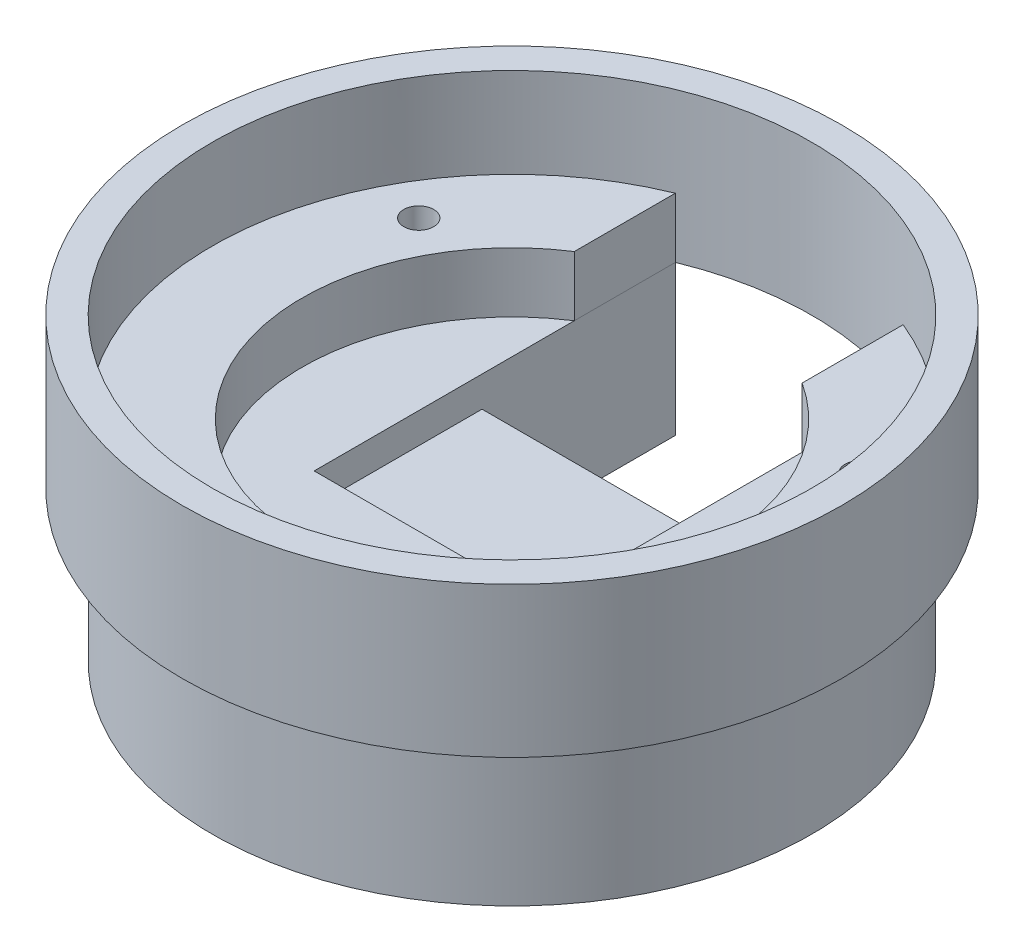
from build123d import *

# Parameters (mm, degrees)
SKETCH1_R                           = 27.5
SKETCH1_R_2                         = 25
BOSS_EXTRUDE1_DEPTH                 = 12.5
BOSS_EXTRUDE2_START                 = 12.5
SKETCH2_R                           = 25
BOSS_EXTRUDE2_DEPTH                 = 12.5
SKETCH3_R                           = 25
SKETCH3_R_2                         = 17.5
BOSS_EXTRUDE3_DEPTH                 = 5
SKETCH4_W                           = 19
SKETCH4_H                           = 14
CUT_EXTRUDE5_DEPTH                  = 2.54
CUT_EXTRUDE2_START                  = -12.5
CUT_EXTRUDE2_DEPTH                  = 12.5
CUT_EXTRUDE6_START                  = -5
CUT_EXTRUDE6_DEPTH                  = 5
TAP_START                           = -12.5
TAP_DRILL_FOR_M3X0_5_TAP1_OUTLINE_R = 1.25
TAP_DRILL_FOR_M3X0_5_TAP1_DEPTH     = 17.5


# Read off the part's stored shape, not the designer's step: Cut-Extrude2, Tap Drill for M3x0.5 Tap1
with BuildPart() as part:
    # Sketch1 → Boss-Extrude1 (new body)
    with BuildSketch(Plane(origin=(0, 0, 0), x_dir=(1, 0, 0), z_dir=(0, 1, 0))):
        with Locations(Location((0, 0, 0), (0, 0, 270))):
            Circle(SKETCH1_R)
        with Locations(Location((0, 0, 0), (0, 0, 270))):
            Circle(SKETCH1_R_2, mode=Mode.SUBTRACT)
    extrude(amount=BOSS_EXTRUDE1_DEPTH)

    # Sketch3 → Boss-Extrude3 (add)
    with BuildSketch(Plane(origin=(0, 0, 0), x_dir=(1, 0, 0), z_dir=(0, 1, 0))):
        with Locations(Location((0, 0, 0), (0, 0, 90))):
            Circle(SKETCH3_R)
        with Locations(Location((0, 0, 0), (0, 0, 270))):
            Circle(SKETCH3_R_2, mode=Mode.SUBTRACT)
    extrude(amount=BOSS_EXTRUDE3_DEPTH)

    # Sketch7 → Cut-Extrude6 (cut)
    with BuildSketch(Plane(origin=(0, 5, 0), x_dir=(1, 0, 0), z_dir=(0, 1, 0)).offset(CUT_EXTRUDE6_START)):
        with BuildLine():
            Line((9.5, 14.696938457), (9.5, 23.12466216))
            ThreePointArc((9.5, 23.12466216), (0, 25), (-9.5, 23.12466216))
            Line((-9.5, 23.12466216), (-9.5, 14.696938457))
            ThreePointArc((-9.5, 14.696938457), (0, 17.5), (9.5, 14.696938457))
        make_face()
    extrude(amount=CUT_EXTRUDE6_DEPTH, mode=Mode.SUBTRACT)


with BuildPart() as body_2:
    # Sketch2 → Boss-Extrude2 (new body)
    with BuildSketch(Plane.XZ.offset(BOSS_EXTRUDE2_START)):
        with Locations(Location((0, 0, 0), (0, 0, 270))):
            Circle(SKETCH2_R)
    extrude(amount=-BOSS_EXTRUDE2_DEPTH)

    # Sketch4 → Cut-Extrude5 (cut)
    with BuildSketch(Plane(origin=(0, 0, 0), x_dir=(1, 0, 0), z_dir=(0, 1, 0))):
        Rectangle(SKETCH4_W, SKETCH4_H)
    extrude(amount=-CUT_EXTRUDE5_DEPTH, mode=Mode.SUBTRACT)

    # Cut-Extrude2 outline → Cut-Extrude2 (cut)
    with BuildSketch(Plane(origin=(0, 0, 0), x_dir=(1, 0, 0), z_dir=(0, 1, 0)).offset(CUT_EXTRUDE2_START)):
        with BuildLine():
            ThreePointArc((9.5, 23.12466216), (0, 25), (-9.5, 23.12466216))
            Line((-9.5, 23.12466216), (-9.5, 7))
            Line((-9.5, 7), (9.5, 7))
            Line((9.5, 7), (9.5, 23.12466216))
        make_face()
    extrude(amount=CUT_EXTRUDE2_DEPTH, mode=Mode.SUBTRACT)


with BuildPart() as tap_drill_for_m3x0_5_tap1_tool:
    # Tap Drill for M3x0.5 Tap1 outline → Tap Drill for M3x0.5 Tap1 (new body)
    with BuildSketch(Plane(origin=(0, 0, 0), x_dir=(1, 0, 0), z_dir=(0, 1, 0)).offset(TAP_START)):
        with Locations((-18.40303983, 10.625)):
            Circle(TAP_DRILL_FOR_M3X0_5_TAP1_OUTLINE_R)
        with Locations((0, -21.25)):
            Circle(TAP_DRILL_FOR_M3X0_5_TAP1_OUTLINE_R)
        with Locations((18.40303983, 10.625)):
            Circle(TAP_DRILL_FOR_M3X0_5_TAP1_OUTLINE_R)
    extrude(amount=TAP_DRILL_FOR_M3X0_5_TAP1_DEPTH)


with BuildPart() as part_1:
    add(part.part)

    # Tap Drill for M3x0.5 Tap1: cut by tap_drill_for_m3x0_5_tap1_tool
    add(tap_drill_for_m3x0_5_tap1_tool.part, mode=Mode.SUBTRACT)


with BuildPart() as body_2_1:
    add(body_2.part)

    # Tap Drill for M3x0.5 Tap1: cut by tap_drill_for_m3x0_5_tap1_tool
    add(tap_drill_for_m3x0_5_tap1_tool.part, mode=Mode.SUBTRACT)


solid = Compound([part_1.part, body_2_1.part])
